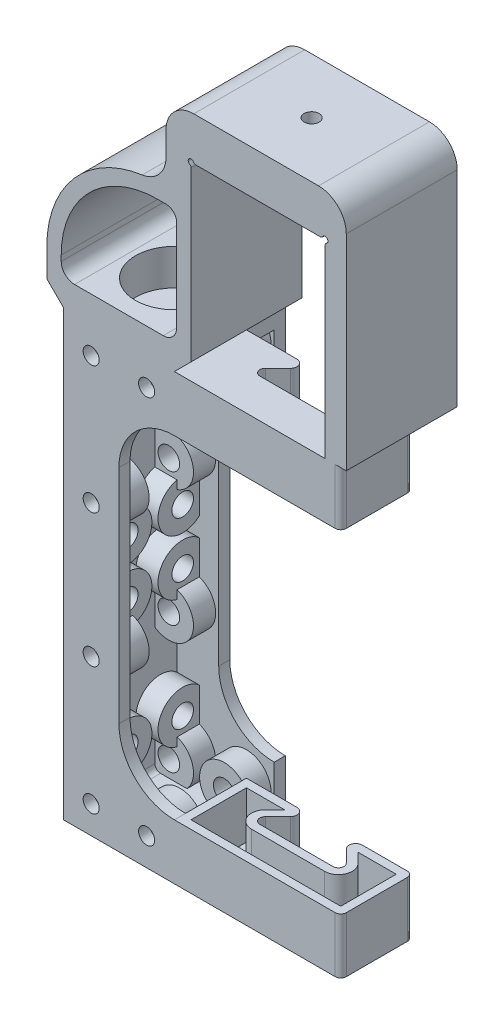
from build123d import *

# Parameters (mm, degrees)
BOSS_EXTRUDE1_DEPTH        = 10
BOSS_EXTRUDE1_DEPTH_BACK   = 10
SKETCH1_W                  = 10
SKETCH1_H                  = 80
BOSS_EXTRUDE2_DEPTH        = 10
BOSS_EXTRUDE2_DEPTH_BACK   = 10
SKETCH2_W                  = 20
SKETCH2_H                  = 10
BOSS_EXTRUDE3_DEPTH        = 10
BOSS_EXTRUDE3_DEPTH_BACK   = 10
SKETCH3_R                  = 10
SKETCH3_R_2                = 6.75
BOSS_EXTRUDE4_DEPTH        = 10
BOSS_EXTRUDE4_DEPTH_BACK   = 10
SKETCH5_W                  = 16
SKETCH5_H                  = 75.5
CUT_EXTRUDE1_DEPTH         = 17.5
M2_5_CLEARANCE_HOLE1_D     = 2.9
SKETCH9_R                  = 4.45
SKETCH9_R_2                = 1.95
BOSS_EXTRUDE5_DEPTH        = 4
M2_5_CLEARANCE_HOLE2_D     = 2.9
M2_5_CLEARANCE_HOLE2_DEPTH = 20
SKETCH15_OUTSIDE_W         = 42.16
SKETCH15_OUTSIDE_H         = 118.91
SKETCH15_OUTSIDE_W_2       = 20
SKETCH15_OUTSIDE_H_2       = 80
CUT_EXTRUDE2_DEPTH         = 30
M2_5_CLEARANCE_HOLE3_D     = 2.9
M2_5_CLEARANCE_HOLE3_DEPTH = 11.5
SKETCH12_R                 = 4.45
SKETCH12_R_2               = 1.95
BOSS_EXTRUDE6_DEPTH        = 4
FILLET2_R                  = 1
BOSS_EXTRUDE7_DEPTH        = 20
CHAMFER2_SIZE              = 3
FILLET3_R                  = 2
CUT_EXTRUDE3_DEPTH         = 29
SKETCH20_R                 = 7
CUT_EXTRUDE4_DEPTH         = 6.5
FILLET4_R                  = 10
BOSS_EXTRUDE8_DEPTH        = 10
FILLET5_R                  = 1
FILLET6_R                  = 1.2
CUT_EXTRUDE7_DEPTH         = 8.5
MIRROR4_START              = 30
MIRROR4_DEPTH              = 10
MIRROR4_START_2            = 38.5
MIRROR4_2_DEPTH            = 1.5
BOSS_EXTRUDE9_START        = -20
BOSS_EXTRUDE9_DEPTH        = 20
FILLET7_R                  = 5
CUT_EXTRUDE8_REACH         = 98.125
SKETCH25_R                 = 0.5
FILLET8_R                  = 0.5
M2_5_CLEARANCE_HOLE4_D     = 2.7
HOLE1_D                    = 3.9
HOLE1_DEPTH                = 4.45


# Read off the part's stored shape, not the designer's step: Mirror4
with BuildPart() as part:
    # Sketch1 → Boss-Extrude1 (new, two sides: drawn at the far end of the back side and taken through both)
    with BuildSketch(Plane.XY.offset(-BOSS_EXTRUDE1_DEPTH_BACK)):
        Rectangle(SKETCH1_W, SKETCH1_H)
    extrude(amount=BOSS_EXTRUDE1_DEPTH + BOSS_EXTRUDE1_DEPTH_BACK)

    # Sketch2 → Boss-Extrude2 (add, two sides: drawn at the far end of the back side and taken through both)
    with BuildSketch(Plane.XY.offset(-BOSS_EXTRUDE2_DEPTH_BACK)):
        with Locations((5, 35)):
            Rectangle(SKETCH2_W, SKETCH2_H)
        with Locations((5, -35)):
            Rectangle(SKETCH2_W, SKETCH2_H)
    extrude(amount=BOSS_EXTRUDE2_DEPTH + BOSS_EXTRUDE2_DEPTH_BACK)

    # Sketch3 → Boss-Extrude3 (add, two sides: drawn at the far end of the back side and taken through both)
    with BuildSketch(Plane.XY.offset(-BOSS_EXTRUDE3_DEPTH_BACK)):
        with Locations((5, 46.75)):
            Circle(SKETCH3_R)
        with Locations((5, 46.75)):
            Circle(SKETCH3_R_2, mode=Mode.SUBTRACT)
    extrude(amount=BOSS_EXTRUDE3_DEPTH + BOSS_EXTRUDE3_DEPTH_BACK)

    # Sketch4 → Boss-Extrude4 (add, two sides: drawn at the far end of the back side and taken through both)
    with BuildSketch(Plane.XY.offset(-BOSS_EXTRUDE4_DEPTH_BACK)):
        Polygon((-5, 46.75), (-5, 40), (-2.378177282, 40), align=None)
        Polygon((12.378177282, 40), (15, 46.75), (15, 40), align=None)
    extrude(amount=BOSS_EXTRUDE4_DEPTH + BOSS_EXTRUDE4_DEPTH_BACK)

    # Sketch5 → Cut-Extrude1 (cut)
    with BuildSketch(Plane(origin=(15, 0, 0), x_dir=(0, 0, -1), z_dir=(1, 0, 0))):
        with Locations((0, -0.25)):
            Rectangle(SKETCH5_W, SKETCH5_H)
    extrude(amount=-CUT_EXTRUDE1_DEPTH, mode=Mode.SUBTRACT)

    # M2.5 Clearance Hole1 (through all)
    with Locations(Plane.XY.offset(10)):
        with Locations((0, -35), (0, -12), (10, -35)):
            m2_5_clearance_hole1 = Hole(M2_5_CLEARANCE_HOLE1_D / 2)

    # Mirror1: M2.5 Clearance Hole1 across plane
    add(m2_5_clearance_hole1.mirror(Plane.ZX), mode=Mode.SUBTRACT)

    # Sketch9 → Boss-Extrude5 (add)
    # profile 1 of 6: a face of its own
    with BuildSketch(Plane.XY.offset(-8)):
        with Locations((10, 35)):
            Circle(SKETCH9_R)
        with Locations((10, 35)):
            Circle(SKETCH9_R_2, mode=Mode.SUBTRACT)
    # profile 2 of 6: a face of its own
    with BuildSketch(Plane.XY.offset(-8)):
        with Locations((0, 35)):
            Circle(SKETCH9_R)
        with Locations((0, 35)):
            Circle(SKETCH9_R_2, mode=Mode.SUBTRACT)
    # profile 3 of 6: a face of its own
    with BuildSketch(Plane.XY.offset(-8)):
        with Locations((0, 12)):
            Circle(SKETCH9_R)
        with Locations((0, 12)):
            Circle(SKETCH9_R_2, mode=Mode.SUBTRACT)
    # profile 4 of 6: a face of its own
    with BuildSketch(Plane.XY.offset(-8)):
        with Locations((0, -12)):
            Circle(SKETCH9_R)
        with Locations((0, -12)):
            Circle(SKETCH9_R_2, mode=Mode.SUBTRACT)
    # profile 5 of 6: a face of its own
    with BuildSketch(Plane.XY.offset(-8)):
        with Locations((0, -35)):
            Circle(SKETCH9_R)
        with Locations((0, -35)):
            Circle(SKETCH9_R_2, mode=Mode.SUBTRACT)
    # profile 6 of 6: a face of its own
    with BuildSketch(Plane.XY.offset(-8)):
        with Locations((10, -35)):
            Circle(SKETCH9_R)
        with Locations((10, -35)):
            Circle(SKETCH9_R_2, mode=Mode.SUBTRACT)
    boss_extrude5 = extrude(amount=BOSS_EXTRUDE5_DEPTH)

    # Mirror2: Boss-Extrude5 across plane
    add(boss_extrude5.mirror(Plane.XY))

    # M2.5 Clearance Hole2
    with Locations(Plane.ZY.offset(5)):
        with Locations((5, 5), (0, 0), (-5, 5), (-5, -5), (5, -5)):
            Hole(M2_5_CLEARANCE_HOLE2_D / 2, depth=M2_5_CLEARANCE_HOLE2_DEPTH)

    # Sketch15 outside → Cut-Extrude2 (cut)
    with BuildSketch(Plane.XY.offset(10)):
        with Locations((5, 8.375)):
            Rectangle(SKETCH15_OUTSIDE_W, SKETCH15_OUTSIDE_H)
        with Locations((5, 0)):
            Rectangle(SKETCH15_OUTSIDE_W_2, SKETCH15_OUTSIDE_H_2, mode=Mode.SUBTRACT)
    extrude(amount=-CUT_EXTRUDE2_DEPTH, mode=Mode.SUBTRACT)

    # M2.5 Clearance Hole3
    with Locations(Plane(origin=(-2.5, 0, 0), x_dir=(0, 0, -1), z_dir=(1, 0, 0))):
        with Locations((5, 28), (-5, 28), (-5, -28), (5, -28)):
            Hole(M2_5_CLEARANCE_HOLE3_D / 2, depth=M2_5_CLEARANCE_HOLE3_DEPTH)

    # Sketch12 → Boss-Extrude6 (add)
    # profile 1 of 8: a face of its own
    with BuildSketch(Plane(origin=(-2.5, 0, 0), x_dir=(0, 0, -1), z_dir=(1, 0, 0))):
        with Locations((-5, -5)):
            Circle(SKETCH12_R)
        with Locations((-5, -5)):
            Circle(SKETCH12_R_2, mode=Mode.SUBTRACT)
    # profile 2 of 8: a face of its own
    with BuildSketch(Plane(origin=(-2.5, 0, 0), x_dir=(0, 0, -1), z_dir=(1, 0, 0))):
        with Locations((5, -5)):
            Circle(SKETCH12_R)
        with Locations((5, -5)):
            Circle(SKETCH12_R_2, mode=Mode.SUBTRACT)
    # profile 3 of 8: a face of its own
    with BuildSketch(Plane(origin=(-2.5, 0, 0), x_dir=(0, 0, -1), z_dir=(1, 0, 0))):
        with Locations((5, 5)):
            Circle(SKETCH12_R)
        with Locations((5, 5)):
            Circle(SKETCH12_R_2, mode=Mode.SUBTRACT)
    # profile 4 of 8: a face of its own
    with BuildSketch(Plane(origin=(-2.5, 0, 0), x_dir=(0, 0, -1), z_dir=(1, 0, 0))):
        with Locations((-5, 5)):
            Circle(SKETCH12_R)
        with Locations((-5, 5)):
            Circle(SKETCH12_R_2, mode=Mode.SUBTRACT)
    # profile 5 of 8: a face of its own
    with BuildSketch(Plane(origin=(-2.5, 0, 0), x_dir=(0, 0, -1), z_dir=(1, 0, 0))):
        with Locations((5, 28)):
            Circle(SKETCH12_R)
        with Locations((5, 28)):
            Circle(SKETCH12_R_2, mode=Mode.SUBTRACT)
    # profile 6 of 8: a face of its own
    with BuildSketch(Plane(origin=(-2.5, 0, 0), x_dir=(0, 0, -1), z_dir=(1, 0, 0))):
        with Locations((-5, 28)):
            Circle(SKETCH12_R)
        with Locations((-5, 28)):
            Circle(SKETCH12_R_2, mode=Mode.SUBTRACT)
    # profile 7 of 8: a face of its own
    with BuildSketch(Plane(origin=(-2.5, 0, 0), x_dir=(0, 0, -1), z_dir=(1, 0, 0))):
        with Locations((5, -28)):
            Circle(SKETCH12_R)
        with Locations((5, -28)):
            Circle(SKETCH12_R_2, mode=Mode.SUBTRACT)
    # profile 8 of 8: a face of its own
    with BuildSketch(Plane(origin=(-2.5, 0, 0), x_dir=(0, 0, -1), z_dir=(1, 0, 0))):
        with Locations((-5, -28)):
            Circle(SKETCH12_R)
        with Locations((-5, -28)):
            Circle(SKETCH12_R_2, mode=Mode.SUBTRACT)
    extrude(amount=BOSS_EXTRUDE6_DEPTH)

    # Fillet2
    fillet2_edges = [part.edges().sort_by_distance(p)[0] for p in [
        (-2.5, 37.5, 0),
        (-2.5, -38, 0),
    ]]
    fillet(fillet2_edges, radius=FILLET2_R)

    # Sketch16 → Boss-Extrude7 (add)
    with BuildSketch(Plane(origin=(0, 0, -10), x_dir=(-1, 0, 0), z_dir=(0, 0, -1))):
        with BuildLine():
            Line((-18, 63.5), (-18, 40))
            Line((-18, 40), (8, 40))
            Line((8, 40), (8, 48))
            ThreePointArc((8, 48), (2.142135624, 62.142135624), (-12, 68))
            Line((-12, 68), (-13.5, 68))
            ThreePointArc((-13.5, 68), (-16.681980515, 66.681980515), (-18, 63.5))
        make_face()
        with BuildLine():
            Line((-15, 63.5), (-15, 45))
            Line((-15, 45), (5, 45))
            Line((5, 45), (5, 48))
            ThreePointArc((5, 48), (0.02081528, 60.02081528), (-12, 65))
            Line((-12, 65), (-13.5, 65))
            ThreePointArc((-13.5, 65), (-14.560660172, 64.560660172), (-15, 63.5))
        make_face(mode=Mode.SUBTRACT)
    extrude(amount=-BOSS_EXTRUDE7_DEPTH)

    # Chamfer2
    chamfer2_edges = [part.edges().sort_by_distance(p)[0] for p in [
        (-8, 40, 0),
        (18, 40, 0),
    ]]
    chamfer(chamfer2_edges, length=CHAMFER2_SIZE - 0.0001)  # a hair under: the kernel refuses the full size

    # Fillet3
    fillet3_edges = [part.edges().sort_by_distance(p)[0] for p in [
        (-5, 45, 0),
        (15, 45, 0),
    ]]
    fillet(fillet3_edges, radius=FILLET3_R)

    # Sketch19 → Cut-Extrude3 (cut)
    with BuildSketch(Plane(origin=(0, 0, -10), x_dir=(-1, 0, 0), z_dir=(0, 0, -1))):
        with BuildLine():
            Line((-13, 44.6), (3, 44.6))
            ThreePointArc((3, 44.6), (4.697056275, 45.302943725), (5.4, 47))
            Line((5.4, 47), (5.4, 48))
            ThreePointArc((5.4, 48), (0.303657993, 60.303657993), (-12, 65.4))
            Line((-12, 65.4), (-13.5, 65.4))
            ThreePointArc((-13.5, 65.4), (-14.843502884, 64.843502884), (-15.4, 63.5))
            Line((-15.4, 63.5), (-15.4, 47))
            ThreePointArc((-15.4, 47), (-14.697056275, 45.302943725), (-13, 44.6))
        make_face()
    extrude(amount=-CUT_EXTRUDE3_DEPTH, mode=Mode.SUBTRACT)

    # Sketch20 → Cut-Extrude4 (cut)
    with BuildSketch(Plane(origin=(0, 44.6, 0), x_dir=(1, 0, 0), z_dir=(0, 1, 0))):
        with Locations(Location((5, 0, 0), (0, 0, 270))):
            Circle(SKETCH20_R)
    extrude(amount=-CUT_EXTRUDE4_DEPTH, mode=Mode.SUBTRACT)

    # Fillet4
    fillet4_edges = [part.edges().sort_by_distance(p)[0] for p in [
        (5, 30, 9),
        (5, 30, -9),
        (5, -30, -9),
        (5, -30, 9),
    ]]
    fillet(fillet4_edges, radius=FILLET4_R - 0.0001)  # a hair under: the kernel refuses the full size

    # Sketch21 → Boss-Extrude8 (add)
    with BuildSketch(Plane.XZ.offset(40)):
        Polygon((15, 10), (45, 10), (45, -3), (33, -3), (39, 3), (21, 3), (27, -3), (15, -3), align=None)
    extrude(amount=-BOSS_EXTRUDE8_DEPTH)

    # Fillet5
    fillet5_edges = [part.edges().sort_by_distance(p)[0] for p in [
        (45, -35, 10),
        (45, -35, -3),
        (39, -35, 3),
        (21, -35, 3),
    ]]
    fillet(fillet5_edges, radius=FILLET5_R)

    # Fillet6
    fillet6_edges = [part.edges().sort_by_distance(p)[0] for p in [
        (33, -35, -3),
        (27, -35, -3),
    ]]
    fillet(fillet6_edges, radius=FILLET6_R)

    # Sketch23 → Cut-Extrude7 (cut)
    with BuildSketch(Plane(origin=(0, -30, 0), x_dir=(1, 0, 0), z_dir=(0, 1, 0))):
        with BuildLine():
            Line((16.5, -8.5), (43.5, -8.5))
            Line((43.5, -8.5), (43.5, 1.5))
            Line((43.5, 1.5), (36.621320344, 1.5))
            Line((36.621320344, 1.5), (38.353553391, -0.232233047))
            ThreePointArc((38.353553391, -0.232233047), (38.895485269, -2.956708581), (36.585786438, -4.5))
            Line((36.585786438, -4.5), (23.414213562, -4.5))
            ThreePointArc((23.414213562, -4.5), (21.104514731, -2.956708581), (21.646446609, -0.232233047))
            Line((21.646446609, -0.232233047), (23.378679656, 1.5))
            Line((23.378679656, 1.5), (16.5, 1.5))
            Line((16.5, 1.5), (16.5, -8))
            Line((16.5, -8), (16.5, -8.5))
        make_face()
    extrude(amount=-CUT_EXTRUDE7_DEPTH, mode=Mode.SUBTRACT)

    # Mirror4 outline → Mirror4 (add)
    with BuildSketch(Plane(origin=(0, 0, 0), x_dir=(1, 0, 0), z_dir=(0, 1, 0)).offset(MIRROR4_START)):
        with BuildLine():
            Line((15, 3), (15, -10))
            Line((15, -10), (44, -10))
            ThreePointArc((44, -10), (44.707106781, -9.707106781), (45, -9))
            Line((45, -9), (45, 2))
            ThreePointArc((45, 2), (44.707106781, 2.707106781), (44, 3))
            Line((44, 3), (35.897056275, 3))
            ThreePointArc((35.897056275, 3), (34.788400836, 2.259220119), (35.048528137, 0.951471863))
            Line((35.048528137, 0.951471863), (37.292893219, -1.292893219))
            ThreePointArc((37.292893219, -1.292893219), (37.50966597, -2.382683432), (36.585786438, -3))
            Line((36.585786438, -3), (23.414213562, -3))
            ThreePointArc((23.414213562, -3), (22.49033403, -2.382683432), (22.707106781, -1.292893219))
            Line((22.707106781, -1.292893219), (24.951471863, 0.951471863))
            ThreePointArc((24.951471863, 0.951471863), (25.211599164, 2.259220119), (24.102943725, 3))
            Line((24.102943725, 3), (15, 3))
        make_face()
        with BuildLine():
            Line((43.5, -8.5), (16.5, -8.5))
            Line((16.5, -8.5), (16.5, 1.5))
            Line((16.5, 1.5), (23.378679656, 1.5))
            Line((23.378679656, 1.5), (21.646446609, -0.232233047))
            ThreePointArc((21.646446609, -0.232233047), (21.104514731, -2.956708581), (23.414213562, -4.5))
            Line((23.414213562, -4.5), (36.585786438, -4.5))
            ThreePointArc((36.585786438, -4.5), (38.895485269, -2.956708581), (38.353553391, -0.232233047))
            Line((38.353553391, -0.232233047), (36.621320344, 1.5))
            Line((36.621320344, 1.5), (43.5, 1.5))
            Line((43.5, 1.5), (43.5, -8.5))
        make_face(mode=Mode.SUBTRACT)
    extrude(amount=MIRROR4_DEPTH)

    # Mirror4 2 outline → Mirror4 2 (add)
    with BuildSketch(Plane(origin=(0, 0, 0), x_dir=(1, 0, 0), z_dir=(0, 1, 0)).offset(MIRROR4_START_2)):
        with BuildLine():
            Line((16.5, 1.5), (16.5, -8.5))
            Line((16.5, -8.5), (43.5, -8.5))
            Line((43.5, -8.5), (43.5, 1.5))
            Line((43.5, 1.5), (36.621320344, 1.5))
            Line((36.621320344, 1.5), (38.353553391, -0.232233047))
            ThreePointArc((38.353553391, -0.232233047), (38.895485269, -2.956708581), (36.585786438, -4.5))
            Line((36.585786438, -4.5), (23.414213562, -4.5))
            ThreePointArc((23.414213562, -4.5), (21.104514731, -2.956708581), (21.646446609, -0.232233047))
            Line((21.646446609, -0.232233047), (23.378679656, 1.5))
            Line((23.378679656, 1.5), (16.5, 1.5))
        make_face()
    extrude(amount=MIRROR4_2_DEPTH)

    # Sketch24 → Boss-Extrude9 (add)
    with BuildSketch(Plane(origin=(0, 0, -10), x_dir=(-1, 0, 0), z_dir=(0, 0, -1)).offset(BOSS_EXTRUDE9_START)):
        with BuildLine():
            Line((-13.5, 82), (-18, 82))
            Line((-18, 82), (-46, 82))
            Line((-46, 82), (-46, 40))
            Line((-46, 40), (-42.2, 40))
            Line((-42.2, 40), (-42.2, 74.2))
            Line((-42.2, 74.2), (-18, 74.2))
            Line((-18, 74.2), (-18, 63.5))
            ThreePointArc((-18, 63.5), (-16.681980515, 66.681980515), (-13.5, 68))
            Line((-13.5, 68), (-13.5, 82))
        make_face()
    extrude(amount=BOSS_EXTRUDE9_DEPTH)

    # Fillet7
    fillet7_edges = [part.edges().sort_by_distance(p)[0] for p in [
        (13.5, 68, 0),
        (46, 82, 0),
        (13.5, 82, 0),
    ]]
    fillet(fillet7_edges, radius=FILLET7_R)

    # Sketch25 → Cut-Extrude8 (cut, up to next)
    with BuildSketch(Plane.XY.offset(10), mode=Mode.PRIVATE) as cut_extrude8_sk1:
        with Locations((18, 74.2)):
            Circle(SKETCH25_R)
    cut_extrude8_tool1 = extrude(cut_extrude8_sk1.sketch, amount=-CUT_EXTRUDE8_REACH, mode=Mode.PRIVATE) & part.part
    # Sketch25 → Cut-Extrude8 (cut, up to next)
    with BuildSketch(Plane.XY.offset(10), mode=Mode.PRIVATE) as cut_extrude8_sk2:
        with Locations((42.2, 74.2)):
            Circle(SKETCH25_R)
    cut_extrude8_tool2 = extrude(cut_extrude8_sk2.sketch, amount=-CUT_EXTRUDE8_REACH, mode=Mode.PRIVATE) & part.part
    add(cut_extrude8_tool1.solids().sort_by_distance((18, 74.2, 10))[0], mode=Mode.SUBTRACT)
    add(cut_extrude8_tool2.solids().sort_by_distance((42.2, 74.2, 10))[0], mode=Mode.SUBTRACT)

    # Fillet8
    fillet8_edges = [part.edges().sort_by_distance(p)[0] for p in [
        (18, 73.7, 0),
        (18.5, 74.2, 0),
        (41.7, 74.2, 0),
        (42.2, 73.7, 0),
    ]]
    fillet(fillet8_edges, radius=FILLET8_R)

    # M2.5 Clearance Hole4 (through all)
    with Locations(Plane(origin=(0, 82, 0), x_dir=(1, 0, 0), z_dir=(0, 1, 0))):
        with Locations((29.75, 0)):
            Hole(M2_5_CLEARANCE_HOLE4_D / 2)

    # Hole1
    with Locations(Plane(origin=(0, 74.2, 0), x_dir=(-1, 0, 0), z_dir=(0, -1, 0))):
        with Locations((-29.75, 0)):
            Hole(HOLE1_D / 2, depth=HOLE1_DEPTH)


solid = part.part
